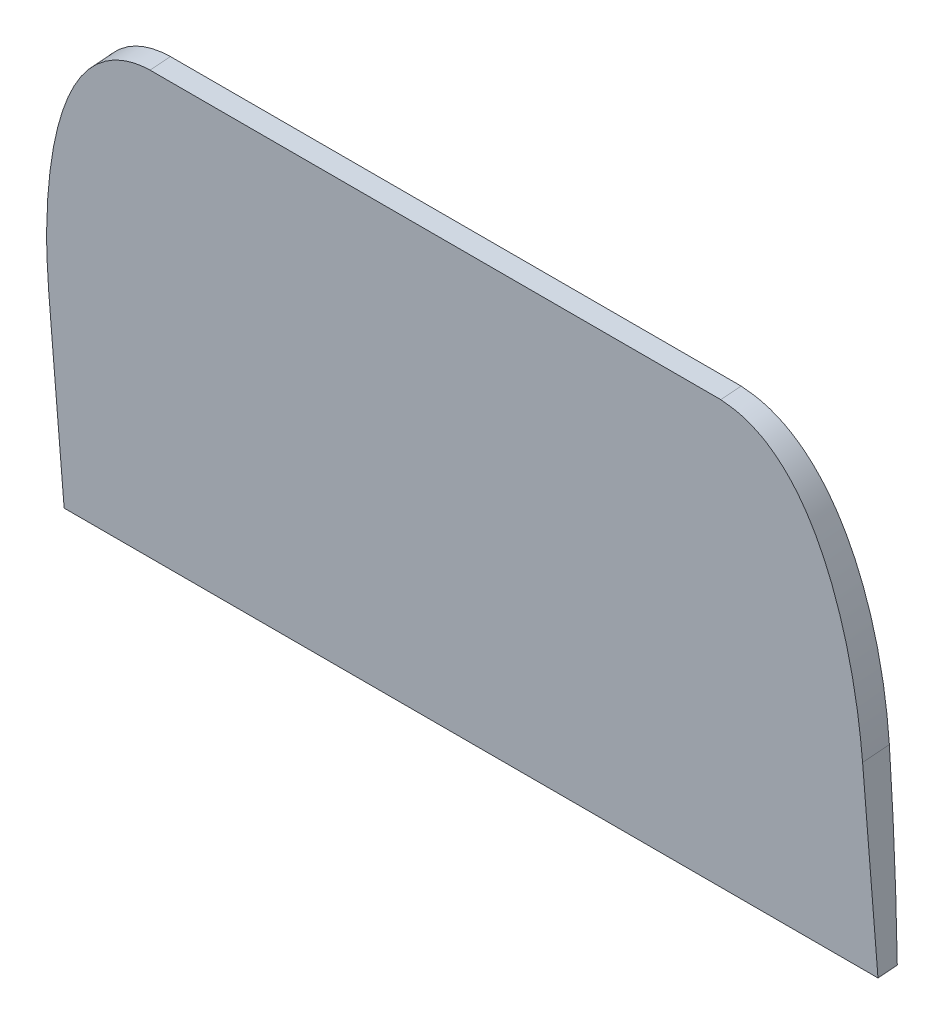
from build123d import *

# Parameters (mm, degrees)
BOSS_EXTRUDE1_DEPTH     = 10
CUT_EXTRUDE1_DEPTH      = 61.928133485
CUT_EXTRUDE1_DEPTH_BACK = 61.928133485


with BuildPart() as part:
    # Sketch1 → Boss-Extrude1 (new body)
    with BuildSketch(Plane(origin=(0, 1.945661651, -24.597655762), x_dir=(-1, 0, 0), z_dir=(8.201772594418346e-15, 0.07885317802352283, -0.9968862404083982))):
        with BuildLine():
            Line((20.118741527, 38.927510312), (-20.205875274, 38.927510312))
            add(Edge.make_bspline(
                [(-20.205875274, 38.927510312), (-20.634098963, 38.892508679), (-21.245835645, 38.778527706), (-21.793411937, 38.641980138), (-22.83466937, 38.198372766), (-23.803353052, 37.478891051), (-24.412556983, 36.884589854), (-24.877490419, 36.344634644), (-25.274800342, 35.805277697), (-25.669505912, 35.18759196), (-25.991077332, 34.611835039), (-26.32458833, 33.935091847), (-26.581827221, 33.349429206), (-26.836336049, 32.707670323), (-27.074080176, 32.039745124), (-27.305049825, 31.313313179), (-27.481649368, 30.696229384), (-27.655403582, 30.02827487), (-27.816800686, 29.340274847), (-27.971090091, 28.607665746), (-28.095711792, 27.948768651), (-28.241597872, 27.08964074), (-28.41706896, 25.841083684), (-28.566039373, 24.442848024), (-28.660522397, 23.195980042), (-28.698123211, 22.438130684), (-28.713170303, 22.033583315), (-28.72027007, 21.807636048), (-28.725707261, 21.608687715), (-28.728334052, 21.498509224), (-28.732226056, 21.320526835), (-28.742152393, 20.794672691), (-28.75, 20.202294151)],
                knots=[0.000338989, 0.000338989, 0.000338989, 0.039386118, 0.055004969, 0.094052098, 0.156527504, 0.203384058, 0.234621761, 0.265859464, 0.297097167, 0.32833487, 0.359572573, 0.390810276, 0.422047979, 0.453285682, 0.484523385, 0.515761088, 0.546998791, 0.578236494, 0.609474197, 0.640711899, 0.671949602, 0.718806157, 0.781281563, 0.843756969, 0.890613523, 0.9140418, 0.925755939, 0.933565364, 0.94137479, 0.949184216, 0.960898355, 0.999945483, 0.999945483, 0.999945483], degree=2))
            Line((-28.75, 20.202294151), (-28.75, 6.427510312))
            Line((-28.75, 6.427510312), (28.75, 6.427510312))
            Line((28.75, 6.427510312), (28.75, 20.202249554))
            add(Edge.make_bspline(
                [(28.75, 20.202249554), (28.742136693, 20.796879453), (28.732153075, 21.324936339), (28.728235159, 21.503651904), (28.725584002, 21.614499101), (28.720117851, 21.813723731), (28.712966508, 22.040249775), (28.697791077, 22.446118641), (28.659754195, 23.208534642), (28.564499372, 24.459675982), (28.41440803, 25.863683892), (28.236422496, 27.123346764), (28.088268606, 27.990052525), (27.961749799, 28.654446766), (27.804153919, 29.396998515), (27.639250072, 30.093405593), (27.461661247, 30.768996368), (27.280351534, 31.39492368), (27.047223746, 32.118771853), (26.806541555, 32.786223535), (26.548675473, 33.427949309), (26.320925204, 33.938978857), (26.120412213, 34.352471329), (25.92443028, 34.732794288), (25.622678502, 35.265443849), (25.234423765, 35.863259987), (24.830722495, 36.402891666), (24.353019395, 36.948050348), (23.75151585, 37.525160308), (22.759896414, 38.235388353), (21.166231977, 38.900698382), (20.118741527, 38.927510312)],
                knots=[5.4217e-05, 5.4217e-05, 5.4217e-05, 0.039105236, 0.050820541, 0.058630745, 0.066440949, 0.074251153, 0.085966458, 0.109397069, 0.156258292, 0.218739922, 0.281221552, 0.328082774, 0.359323589, 0.390564404, 0.421805219, 0.453046034, 0.484286849, 0.515527664, 0.546768479, 0.578009294, 0.609250109, 0.63268072, 0.648301127, 0.671731738, 0.702972553, 0.734213368, 0.765454183, 0.796694998, 0.843556221, 0.90603785, 0.999760295, 0.999760295, 0.999760295], degree=2))
        make_face()
    extrude(amount=BOSS_EXTRUDE1_DEPTH)

    # Sketch2 → Cut-Extrude1 (cut, two sides: drawn at the far end of the back side and taken through both)
    with BuildSketch(Plane(origin=(0, 0, 0), x_dir=(0, 0, -1), z_dir=(1, 0, 0)).offset(-CUT_EXTRUDE1_DEPTH_BACK)):
        with BuildLine():
            Line((43.259032881, 46.073141759), (22.107794841, 46.073141759))
            add(Edge.make_bspline(
                [(25.5, 3.2), (25.5, 6.804109149), (25.372537051, 14.023285861), (24.790435794, 24.776005778), (23.772909366, 35.484880024), (22.745170912, 42.556468877), (22.107794841, 46.073141759)],
                knots=[0, 0, 0, 0, 0.25, 0.5, 0.75, 1, 1, 1, 1], degree=3))
            Line((25.5, 3.2), (43.259032881, 3.2))
            Line((43.259032881, 3.2), (43.259032881, 46.073141759))
        make_face()
    extrude(amount=CUT_EXTRUDE1_DEPTH + CUT_EXTRUDE1_DEPTH_BACK, mode=Mode.SUBTRACT)


solid = part.part
